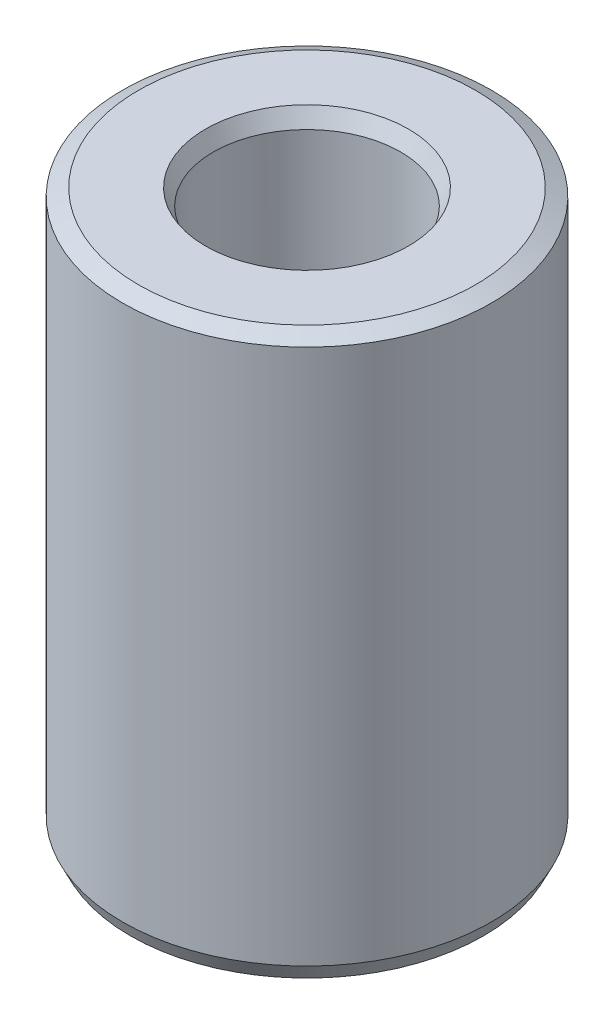
from build123d import *
from OCP.BRepFilletAPI import BRepFilletAPI_MakeChamfer

# Parameters (mm, degrees)
SKETCH1_R           = 25
BOSS_EXTRUDE1_DEPTH = 75.870204221
SKETCH2_R           = 12.688717522
CUT_EXTRUDE1_DEPTH  = 84.70357154
CHAMFER1_SIZE       = 1.060376821
CHAMFER1_SIZE2      = 2.160075701


with BuildPart() as part:
    # Sketch1 → Boss-Extrude1 (new body)
    with BuildSketch(Plane(origin=(0, 0, 0), x_dir=(1, 0, 0), z_dir=(0, 1, 0))):
        Circle(SKETCH1_R)
    extrude(amount=BOSS_EXTRUDE1_DEPTH)

    # Sketch2 → Cut-Extrude1 (cut, through all)
    with BuildSketch(Plane(origin=(0, 0, 0), x_dir=(1, 0, 0), z_dir=(0, 1, 0))):
        Circle(SKETCH2_R)
    extrude(amount=CUT_EXTRUDE1_DEPTH, mode=Mode.SUBTRACT)

    # Chamfer1: one chamfer whose edges measure the first distance from different faces: ONE call of the kernel's chamfer builder (chamfer() names one face for all edges)
    chamfer1_edges_1 = [part.edges().sort_by_distance(p)[0] for p in [
        (-12.688717522, 75.870204221, 0),
    ]]
    chamfer1_side_1 = [part.faces().sort_by_distance(p)[0] for p in [
        (-24.292893219, 75.870204221, 0),
    ]]
    chamfer1_edges_2 = [part.edges().sort_by_distance(p)[0] for p in [
        (-12.688717522, 0, 0),
    ]]
    chamfer1_side_2 = [part.faces().sort_by_distance(p)[0] for p in [
        (-12.688717522, 37.935102111, 0),
    ]]
    chamfer1_edges_3 = [part.edges().sort_by_distance(p)[0] for p in [
        (-25, 0, 0),
    ]]
    chamfer1_side_3 = [part.faces().sort_by_distance(p)[0] for p in [
        (-24.292893219, 0, 0),
    ]]
    chamfer1_edges_4 = [part.edges().sort_by_distance(p)[0] for p in [
        (-25, 75.870204221, 0),
    ]]
    chamfer1_side_4 = [part.faces().sort_by_distance(p)[0] for p in [
        (-25, 37.935102111, 0),
    ]]
    chamfer1 = BRepFilletAPI_MakeChamfer(part.part.solid().wrapped)
    for e in chamfer1_edges_1:
        chamfer1.Add(CHAMFER1_SIZE, CHAMFER1_SIZE2, e.wrapped, chamfer1_side_1[0].wrapped)  # the first distance lies on this face
    for e in chamfer1_edges_2:
        chamfer1.Add(CHAMFER1_SIZE, CHAMFER1_SIZE2, e.wrapped, chamfer1_side_2[0].wrapped)  # the first distance lies on this face
    for e in chamfer1_edges_3:
        chamfer1.Add(CHAMFER1_SIZE, CHAMFER1_SIZE2, e.wrapped, chamfer1_side_3[0].wrapped)  # the first distance lies on this face
    for e in chamfer1_edges_4:
        chamfer1.Add(CHAMFER1_SIZE, CHAMFER1_SIZE2, e.wrapped, chamfer1_side_4[0].wrapped)  # the first distance lies on this face
    add(Compound.cast(chamfer1.Shape()), mode=Mode.REPLACE)


solid = part.part
